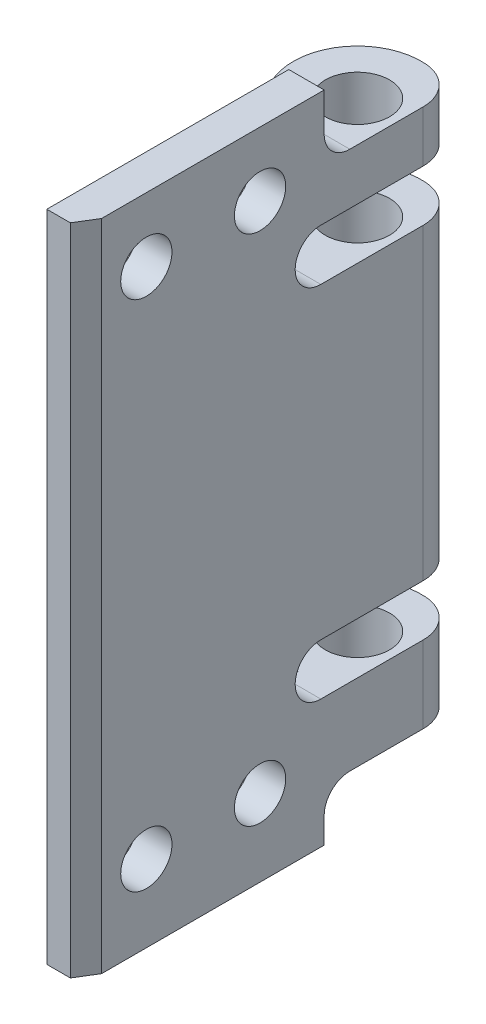
from build123d import *

# Parameters (mm, degrees)
SKETCH1_R           = 2.5
BOSS_EXTRUDE1_DEPTH = 51
CUT_EXTRUDE1_DEPTH  = 15
CUT_EXTRUDE2_DEPTH  = 12.5
SKETCH4_W           = 10.949964099
SKETCH4_H           = 4
CUT_EXTRUDE3_DEPTH  = 25
SKETCH5_R           = 2
CUT_EXTRUDE4_DEPTH  = 10
FILLET4_R           = 2
FILLET5_R           = 3
FILLET6_START       = 57.196631886
FILLET6_DEPTH       = 2.760049196
FILLET6_START_2     = 53.489934113
FILLET6_2_DEPTH     = 3.979721459
FILLET6_START_3     = 57.021910195
FILLET6_3_DEPTH     = 0.447745377
FILLET6_START_4     = 1
FILLET6_4_DEPTH     = 48
FILLET6_START_5     = 46
FILLET6_5_DEPTH     = 2
FILLET6_START_6     = 2
FILLET6_6_DEPTH     = 2
SKETCH6_R           = 1.5
BOSS_EXTRUDE2_DEPTH = 5


with BuildPart() as part:
    # Sketch1 → Boss-Extrude1 (new body)
    with BuildSketch(Plane(origin=(0, 0, 0), x_dir=(1, 0, 0), z_dir=(0, 1, 0))):
        with BuildLine():
            Line((57.196631886, 9.028355512), (57.196631886, 28.639971463))
            ThreePointArc((57.196631886, 28.639971463), (52.044420209, 35.109942461), (59.956681082, 37.518663649))
            Line((59.956681082, 37.518663649), (59.956681082, 29.732723556))
            Line((59.956681082, 29.732723556), (59.956681082, 10.538718377))
            Line((59.956681082, 10.538718377), (59.030643937, 9.028355512))
            Line((59.030643937, 9.028355512), (57.196631886, 9.028355512))
        make_face()
        with Locations(Location((56.81904117, 33.625693603, 0), (0, 0, 270))):
            Circle(SKETCH1_R, mode=Mode.SUBTRACT)
    extrude(amount=BOSS_EXTRUDE1_DEPTH)

    # Sketch2 → Cut-Extrude1 (cut, symmetric)
    with BuildSketch(Plane(origin=(59.956681082, 0, 0), x_dir=(0, 0, -1), z_dir=(1, 0, 0))):
        Polygon((39.133835998, 10), (25.633835998, 10), (25.633835998, 14), (27.895137764, 14), (39.133835998, 14), align=None)
    extrude(amount=CUT_EXTRUDE1_DEPTH, both=True, mode=Mode.SUBTRACT)

    # Sketch3 → Cut-Extrude2 (cut, symmetric)
    with BuildSketch(Plane(origin=(59.956681082, 0, 0), x_dir=(0, 0, -1), z_dir=(1, 0, 0))):
        Polygon((41.711304396, 42), (27.895137764, 42), (25.633835998, 42), (25.633835998, 38), (41.711304396, 38), align=None)
    extrude(amount=CUT_EXTRUDE2_DEPTH, both=True, mode=Mode.SUBTRACT)

    # Sketch4 → Cut-Extrude3 (cut, symmetric)
    with BuildSketch(Plane(origin=(59.956681082, 0, 0), x_dir=(0, 0, -1), z_dir=(1, 0, 0))):
        with Locations((33.370119814, 2)):
            Rectangle(SKETCH4_W, SKETCH4_H)
        Polygon((38.845101863, 51), (30.056521444, 51), (27.895137764, 51), (27.895137764, 47), (27.895137764, 46), (38.845101863, 46), align=None)
    extrude(amount=CUT_EXTRUDE3_DEPTH, both=True, mode=Mode.SUBTRACT)

    # Sketch5 → Cut-Extrude4 (cut)
    with BuildSketch(Plane.ZY.offset(-57.196631886)):
        with Locations((-22.895137764, 46)):
            Circle(SKETCH5_R)
        with Locations((-14.028355512, 46)):
            Circle(SKETCH5_R)
        with Locations((-14.028355512, 6)):
            Circle(SKETCH5_R)
        with Locations((-22.895137764, 6)):
            Circle(SKETCH5_R)
    extrude(amount=-CUT_EXTRUDE4_DEPTH, mode=Mode.SUBTRACT)

    # Fillet4
    fillet4_edges = [part.edges().sort_by_distance(p)[0] for p in [
        (57.196631886, 26, -28.639971463),
    ]]
    fillet(fillet4_edges, radius=FILLET4_R)

    # Fillet5
    fillet5_edges = [part.edges().sort_by_distance(p)[0] for p in [
        (59.956681082, 7, -37.518663649),
        (59.956681082, 26, -37.518663649),
        (59.956681082, 44, -37.518663649),
    ]]
    fillet(fillet5_edges, radius=FILLET5_R)

    # Fillet6: read off the stored shape, not the designer's step
    # Fillet6 outline → Fillet6 (add)
    with BuildSketch(Plane.YZ.offset(FILLET6_START)):
        with BuildLine():
            Line((4, -27.895137764), (2, -27.895137764))
            ThreePointArc((2, -27.895137764), (3.414213563, -28.480924202), (4, -29.895137764))
            Line((4, -29.895137764), (4, -27.895137764))
        make_face()
        with BuildLine():
            Line((46, -27.895137764), (46, -29.895137764))
            ThreePointArc((46, -29.895137764), (46.585786437, -28.480924202), (48, -27.895137764))
            Line((48, -27.895137764), (46, -27.895137764))
        make_face()
        with BuildLine():
            Line((14, -25.633835998), (12, -25.633835998))
            ThreePointArc((12, -25.633835998), (13.414213562, -26.219622436), (14, -27.633835998))
            Line((14, -27.633835998), (14, -25.633835998))
        make_face()
        with BuildLine():
            ThreePointArc((10, -27.633835998), (10.585786438, -26.219622436), (12, -25.633835998))
            Line((12, -25.633835998), (10, -25.633835998))
            Line((10, -25.633835998), (10, -27.633835998))
        make_face()
        with BuildLine():
            Line((38, -25.633835998), (38, -27.633835998))
            ThreePointArc((38, -27.633835998), (38.585786438, -26.219622436), (40, -25.633835998))
            Line((40, -25.633835998), (38, -25.633835998))
        make_face()
        with BuildLine():
            Line((42, -25.633835998), (40, -25.633835998))
            ThreePointArc((40, -25.633835998), (41.414213562, -26.219622436), (42, -27.633835998))
            Line((42, -27.633835998), (42, -25.633835998))
        make_face()
    extrude(amount=FILLET6_DEPTH)

    # Fillet6 2 outline → Fillet6 2 (add)
    with BuildSketch(Plane.YZ.offset(FILLET6_START_2)):
        with BuildLine():
            Line((4, -27.895137764), (2, -27.895137764))
            ThreePointArc((2, -27.895137764), (3.414213563, -28.480924202), (4, -29.895137764))
            Line((4, -29.895137764), (4, -27.895137764))
        make_face()
        with BuildLine():
            Line((46, -27.895137764), (46, -29.895137764))
            ThreePointArc((46, -29.895137764), (46.585786437, -28.480924202), (48, -27.895137764))
            Line((48, -27.895137764), (46, -27.895137764))
        make_face()
    extrude(amount=FILLET6_2_DEPTH)

    # Fillet6 3 outline → Fillet6 3 (add)
    with BuildSketch(Plane.YZ.offset(FILLET6_START_3)):
        with BuildLine():
            Line((14, -25.633835998), (12, -25.633835998))
            ThreePointArc((12, -25.633835998), (13.414213562, -26.219622436), (14, -27.633835998))
            Line((14, -27.633835998), (14, -25.633835998))
        make_face()
        with BuildLine():
            Line((38, -25.633835998), (38, -27.633835998))
            ThreePointArc((38, -27.633835998), (38.585786438, -26.219622436), (40, -25.633835998))
            Line((40, -25.633835998), (38, -25.633835998))
        make_face()
    extrude(amount=FILLET6_3_DEPTH)

    # Fillet6 4 outline → Fillet6 4 (cut)
    with BuildSketch(Plane(origin=(0, 0, 0), x_dir=(1, 0, 0), z_dir=(0, 1, 0)).offset(FILLET6_START_4)):
        with BuildLine():
            ThreePointArc((56.880709526, 27.895137764), (56.354589633, 28.446988989), (55.660177396, 28.761843816))
            ThreePointArc((55.660177396, 28.761843816), (54.504616994, 29.193601463), (53.489934157, 29.895137813))
            Line((53.489934157, 29.895137813), (53.489934113, 27.895137764))
            Line((53.489934113, 27.895137764), (56.880709526, 27.895137764))
        make_face()
        with BuildLine():
            Line((57.196631886, 25.633835998), (57.196631886, 26.816303901))
            ThreePointArc((57.196631886, 26.816303901), (57.152463779, 27.234301039), (57.021910279, 27.633836035))
            Line((57.021910279, 27.633836035), (57.021910195, 25.633835998))
            Line((57.021910195, 25.633835998), (57.196631886, 25.633835998))
        make_face()
    extrude(amount=FILLET6_4_DEPTH, mode=Mode.SUBTRACT)

    # Fillet6 5 outline → Fillet6 5 (cut)
    with BuildSketch(Plane(origin=(0, 0, 0), x_dir=(1, 0, 0), z_dir=(0, 1, 0)).offset(FILLET6_START_5)):
        with BuildLine():
            Line((57.196631886, 27.895137764), (57.196631886, 28.639971463))
            ThreePointArc((57.196631886, 28.639971463), (56.423680429, 28.641349124), (55.660177396, 28.761843815))
            ThreePointArc((55.660177396, 28.761843815), (56.354589633, 28.446988989), (56.880709526, 27.895137764))
            Line((56.880709526, 27.895137764), (57.196631886, 27.895137764))
        make_face()
    extrude(amount=FILLET6_5_DEPTH, mode=Mode.SUBTRACT)

    # Fillet6 6 outline → Fillet6 6 (cut)
    with BuildSketch(Plane(origin=(0, 0, 0), x_dir=(1, 0, 0), z_dir=(0, 1, 0)).offset(FILLET6_START_6)):
        with BuildLine():
            Line((57.196631886, 27.895137764), (57.196631886, 28.639971463))
            ThreePointArc((57.196631886, 28.639971463), (56.423680429, 28.641349124), (55.660177396, 28.761843815))
            ThreePointArc((55.660177396, 28.761843815), (56.354589633, 28.446988989), (56.880709526, 27.895137764))
            Line((56.880709526, 27.895137764), (57.196631886, 27.895137764))
        make_face()
    extrude(amount=FILLET6_6_DEPTH, mode=Mode.SUBTRACT)

    # Sketch6 → Boss-Extrude2 (add)
    with BuildSketch(Plane(origin=(0, 30, 0), x_dir=(1, 0, 0), z_dir=(0, 1, 0))):
        with BuildLine():
            Line((57.196631886, 23.207838196), (57.196631886, 15.88036097))
            add(Edge.make_bspline(
                [(55.511713205, 17.752088745), (56.909946197, 17.31678815), (57.196631886, 15.88036097)],
                knots=[0, 0, 0, 1, 1, 1], degree=2))
            ThreePointArc((55.511713205, 17.752088745), (53.511713205, 19.752088745), (55.511713205, 21.752088745))
            add(Edge.make_bspline(
                [(55.511713205, 21.752088745), (56.732163203, 22.065636669), (57.196631886, 23.207838196)],
                knots=[0, 0, 0, 1, 1, 1], degree=2))
        make_face()
        with Locations(Location((55.511713205, 19.752088745, 0), (0, 0, 270))):
            Circle(SKETCH6_R, mode=Mode.SUBTRACT)
    extrude(amount=BOSS_EXTRUDE2_DEPTH)


solid = part.part
